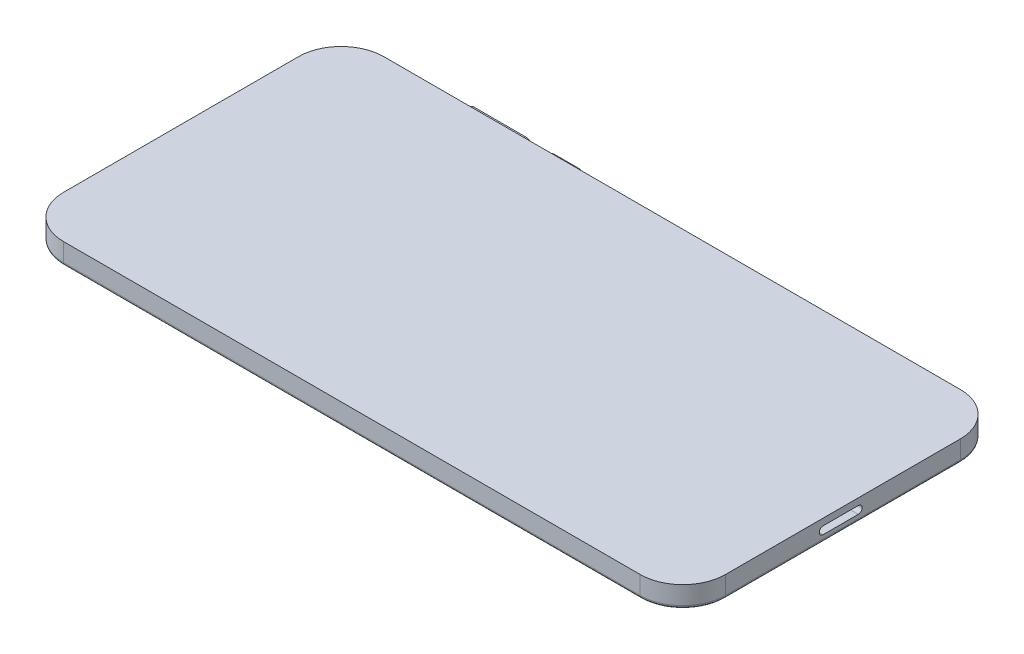
from build123d import *

# Parameters (mm, degrees)
EXTRUDE_1_DEPTH     = 20
CUT_EXTRUDE_1_DEPTH = 50
EXTRUDE_3_DEPTH     = 5
EXTRUDE_4_DEPTH     = 8
FILLET_2_R          = 3


with BuildPart() as part:
    # 草图1 → 凸台-拉伸1 (new body)
    with BuildSketch(Plane(origin=(0, 0, 0), x_dir=(1, 0, 0), z_dir=(0, 1, 0))):
        with BuildLine():
            Line((-50.412191645, 246.464337327), (489.587808355, 246.464337327))
            ThreePointArc((489.587808355, 246.464337327), (517.872079603, 234.748608574), (529.587808355, 206.464337327))
            Line((529.587808355, 206.464337327), (529.587808355, -13.535662673))
            ThreePointArc((529.587808355, -13.535662673), (517.872079603, -41.819933921), (489.587808355, -53.535662673))
            Line((489.587808355, -53.535662673), (-50.412191645, -53.535662673))
            ThreePointArc((-50.412191645, -53.535662673), (-78.696462892, -41.819933921), (-90.412191645, -13.535662673))
            Line((-90.412191645, -13.535662673), (-90.412191645, 206.464337327))
            ThreePointArc((-90.412191645, 206.464337327), (-78.696462892, 234.748608574), (-50.412191645, 246.464337327))
        make_face()
    extrude(amount=EXTRUDE_1_DEPTH)

    # 草图3 → 切除-拉伸1 (cut)
    with BuildSketch(Plane(origin=(529.587808355, 0, 0), x_dir=(0, 0, -1), z_dir=(1, 0, 0))):
        with BuildLine():
            Line((110.894859729, 13.740378627), (77.820523712, 13.740378627))
            ThreePointArc((77.820523712, 13.740378627), (74.239226181, 10.159081096), (77.820523712, 6.577783566))
            Line((77.820523712, 6.577783566), (110.894859729, 6.577783566))
            ThreePointArc((110.894859729, 6.577783566), (114.47615726, 10.159081096), (110.894859729, 13.740378627))
        make_face()
    extrude(amount=-CUT_EXTRUDE_1_DEPTH, mode=Mode.SUBTRACT)

    # 草图7 → 凸台-拉伸3 (add)
    with BuildSketch(Plane(origin=(0, 0, -246.464337327), x_dir=(-1, 0, 0), z_dir=(0, 0, -1))):
        with BuildLine():
            Line((-29.111934793, 4.133607032), (-77.438384999, 4.133607032))
            ThreePointArc((-77.438384999, 4.133607032), (-83.533612953, 10.228834986), (-77.438384999, 16.32406294))
            Line((-77.438384999, 16.32406294), (-29.111934793, 16.32406294))
            ThreePointArc((-29.111934793, 16.32406294), (-23.016706839, 10.228834986), (-29.111934793, 4.133607032))
        make_face()
        with BuildLine():
            Line((-126.97952788, 15.677384408), (-104.60392054, 15.677384408))
            ThreePointArc((-104.60392054, 15.677384408), (-99.155371118, 10.228834986), (-104.60392054, 4.780285564))
            Line((-104.60392054, 4.780285564), (-126.97952788, 4.780285564))
            ThreePointArc((-126.97952788, 4.780285564), (-132.428077301, 10.228834986), (-126.97952788, 15.677384408))
        make_face()
    extrude(amount=EXTRUDE_3_DEPTH)

    # 草图8 → 凸台-拉伸4 (add)
    with BuildSketch(Plane.XZ):
        with BuildLine():
            Line((89.642429689, -218.909715993), (-49.282459322, -218.909715993))
            ThreePointArc((-49.282459322, -218.909715993), (-63.424594946, -213.051851617), (-69.282459322, -198.909715993))
            Line((-69.282459322, -198.909715993), (-69.282459322, -102.637833878))
            ThreePointArc((-69.282459322, -102.637833878), (-63.424594946, -88.495698255), (-49.282459322, -82.637833878))
            Line((-49.282459322, -82.637833878), (89.642429689, -82.637833878))
            ThreePointArc((89.642429689, -82.637833878), (103.784565313, -88.495698255), (109.642429689, -102.637833878))
            Line((109.642429689, -102.637833878), (109.642429689, -198.909715993))
            ThreePointArc((109.642429689, -198.909715993), (103.784565313, -213.051851617), (89.642429689, -218.909715993))
        make_face()
    extrude(amount=EXTRUDE_4_DEPTH)

    # 圆角2
    fillet_2_edges = [part.edges().sort_by_distance(p)[0] for p in [
        (529.587808355, 0, -96.464337327),
        (529.587808355, 10, -206.464337327),
        (529.587808355, 10, 13.535662673),
    ]]
    fillet(fillet_2_edges, radius=FILLET_2_R)


solid = part.part
